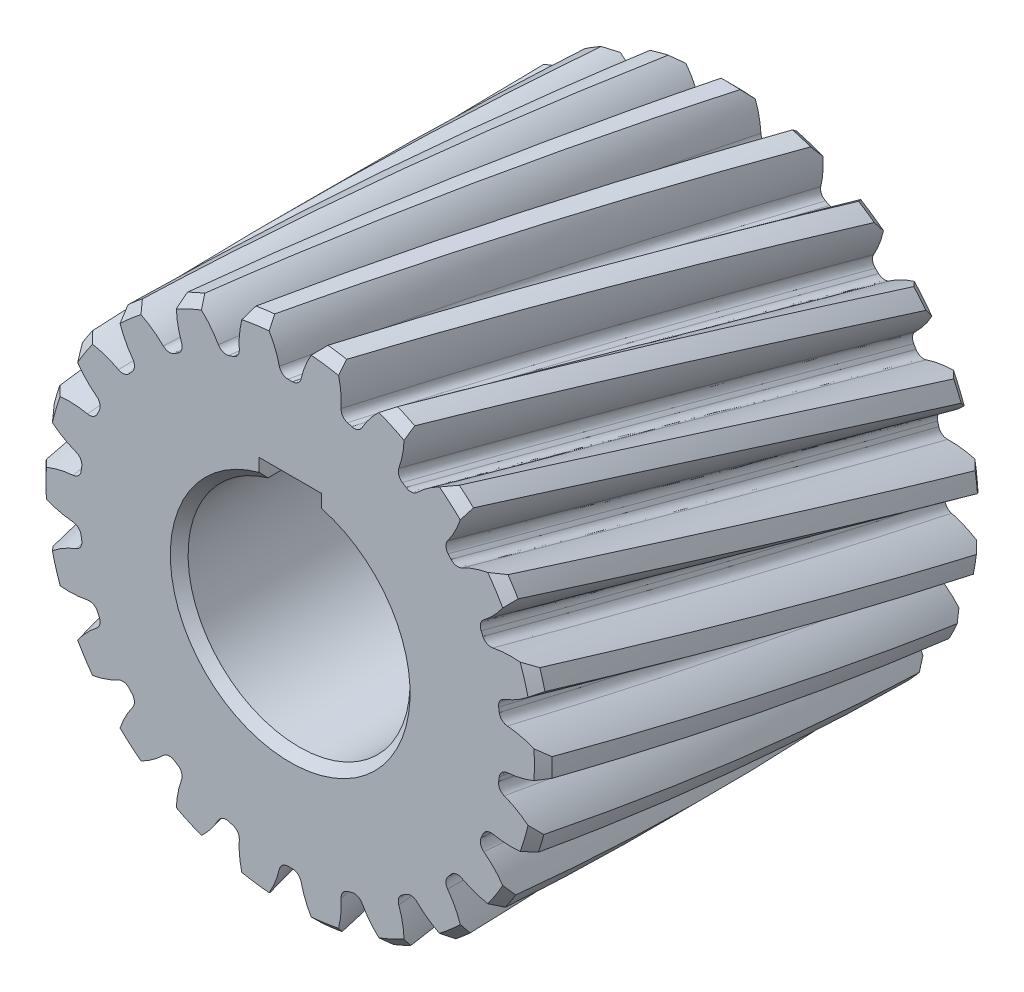
from build123d import *

# Parameters (mm, degrees)
SKETCH1_R           = 57
BOSS_EXTRUDE1_DEPTH = 100
CHAMFER1_SIZE       = 2
CUT_SWEEP1_PITCH    = 1371
CIRPATTERN1_COUNT   = 22


with BuildPart() as part:
    # Sketch1 → Boss-Extrude1 (new body)
    with BuildSketch(Plane.XY):
        Circle(SKETCH1_R)
        with BuildLine():
            Line((7, 24), (7, 29))
            Line((7, 29), (-7, 29))
            Line((-7, 29), (-7, 24))
            ThreePointArc((-7, 24), (0, -25), (7, 24))
        make_face(mode=Mode.SUBTRACT)
    extrude(amount=-BOSS_EXTRUDE1_DEPTH)

    # Chamfer1
    chamfer1_edges = [part.edges().sort_by_distance(p)[0] for p in [
        (-57, 0, 0),
        (-57, 0, -100),
        (0, -25, -100),
        (0, -25, 0),
    ]]
    chamfer(chamfer1_edges, length=CHAMFER1_SIZE)

    # Cut-Sweep1: the profile of Sketch4 screwed along a right-hand helix of 0.072939 turns, 80 arcs to a turn; built about Z, then put on its axis
    cut_sweep1_z = Axis((0, 0, 0), (0, 0, 1))
    cut_sweep1_corners = [(47.5, -0.5, 0), (47.5, 0.5, 0), (49.056300289, 2.450161677, 0), (56.683330883, 6, 0), (56.683330883, -6, 0), (49.056300289, -2.450161677, 0)]
    with BuildLine(mode=Mode.PRIVATE) as cut_sweep1_profile:
        Line(cut_sweep1_corners[0], cut_sweep1_corners[1])
        ThreePointArc((47.5, 0.5, 0), (47.936766265, 1.747517651, 0), (49.056300289, 2.450161677, 0))
        ThreePointArc((49.056300289, 2.450161677, 0), (53.058574061, 3.819522464, 0), (56.683330883, 6, 0))
        ThreePointArc((56.683330883, 6, 0), (57, 0, 0), (56.683330883, -6, 0))
        ThreePointArc((56.683330883, -6, 0), (53.058574061, -3.819522464, 0), (49.056300289, -2.450161677, 0))
        ThreePointArc((49.056300289, -2.450161677, 0), (47.936766265, -1.747517651, 0), (47.5, -0.5, 0))
    cut_sweep1_cap = Face(cut_sweep1_profile.wire())
    cut_sweep1_arcs = [((47.5, 0.5, 0), (47.5, 2.096073092, 0), (49.056300289, 2.450161677, 0), (1, 0.7816168675621441, 1)), ((49.056300289, 2.450161677, 0), (53.251651026, 3.404685566, 0), (56.683330883, 6, 0), (1, 0.9776333196180625, 1)), ((56.683330883, 6, 0), (57.318438232, 0, 0), (56.683330883, -6, 0), (1, 0.9944444014574307, 1)), ((56.683330883, -6, 0), (53.251651026, -3.404685566, 0), (49.056300289, -2.450161677, 0), (1, 0.9776333196180627, 1)), ((49.056300289, -2.450161677, 0), (47.5, -2.096073092, 0), (47.5, -0.5, 0), (1, 0.7816168675621441, 1))]  # start, shoulder, end, weights
    cut_sweep1_turn_angles = [0, 2.25, 4.5, 6.75, 9, 11.25, 13.5, 15.75, 18, 20.25, 22.5, 24.379102845, 26.258205689]
    cut_sweep1_turn_weights = [1, 0.9992290362407229, 1, 0.9992290362407229, 1, 0.9992290362407229, 1, 0.9992290362407229, 1, 0.9992290362407229, 1, 0.9994622419609633, 1]
    cut_sweep1_turn_rails = [Edge.make_bspline([Vector(p[0], p[1], 0).rotate(cut_sweep1_z, cut_sweep1_turn_angles[k]) / cut_sweep1_turn_weights[k] + Vector(0, 0, p[2] + CUT_SWEEP1_PITCH * cut_sweep1_turn_angles[k] / 360) for k in range(13)], [0, 0, 0, 1, 1, 2, 2, 3, 3, 4, 4, 5, 5, 6, 6, 6], 2, cut_sweep1_turn_weights) for p in cut_sweep1_corners]
    cut_sweep1_turn_sides = [*[Face.make_surface_from_curves(cut_sweep1_turn_rails[p[0]], cut_sweep1_turn_rails[p[1]]) for p in [(0, 1)]], *[Face.make_bezier_surface([[Vector(p[j][0], p[j][1], 0).rotate(cut_sweep1_z, cut_sweep1_turn_angles[2 * i + k]) / cut_sweep1_turn_weights[2 * i + k] + Vector(0, 0, p[j][2] + CUT_SWEEP1_PITCH * cut_sweep1_turn_angles[2 * i + k] / 360) for k in range(3)] for j in range(3)], [[p[3][j] * cut_sweep1_turn_weights[2 * i + k] for k in range(3)] for j in range(3)]) for p in cut_sweep1_arcs for i in range(6)]]
    cut_sweep1 = Plane(origin=(0, 0, 0), x_dir=(0, 1, 0), z_dir=(0, 0, -1)) * Solid(Shell([*cut_sweep1_turn_sides, cut_sweep1_cap, cut_sweep1_cap.rotate(cut_sweep1_z, 26.258205689).moved(Location((0, 0, CUT_SWEEP1_PITCH * 26.258205689 / 360)))]))
    add(cut_sweep1, mode=Mode.SUBTRACT)

    # CirPattern1: Cut-Sweep1 ×22 about axis
    cirpattern1_axis = Axis((0, 0, -100), (0, 0, 1))
    for i in range(1, CIRPATTERN1_COUNT):
        add(cut_sweep1.rotate(cirpattern1_axis, i * 360 / CIRPATTERN1_COUNT), mode=Mode.SUBTRACT)


solid = part.part
